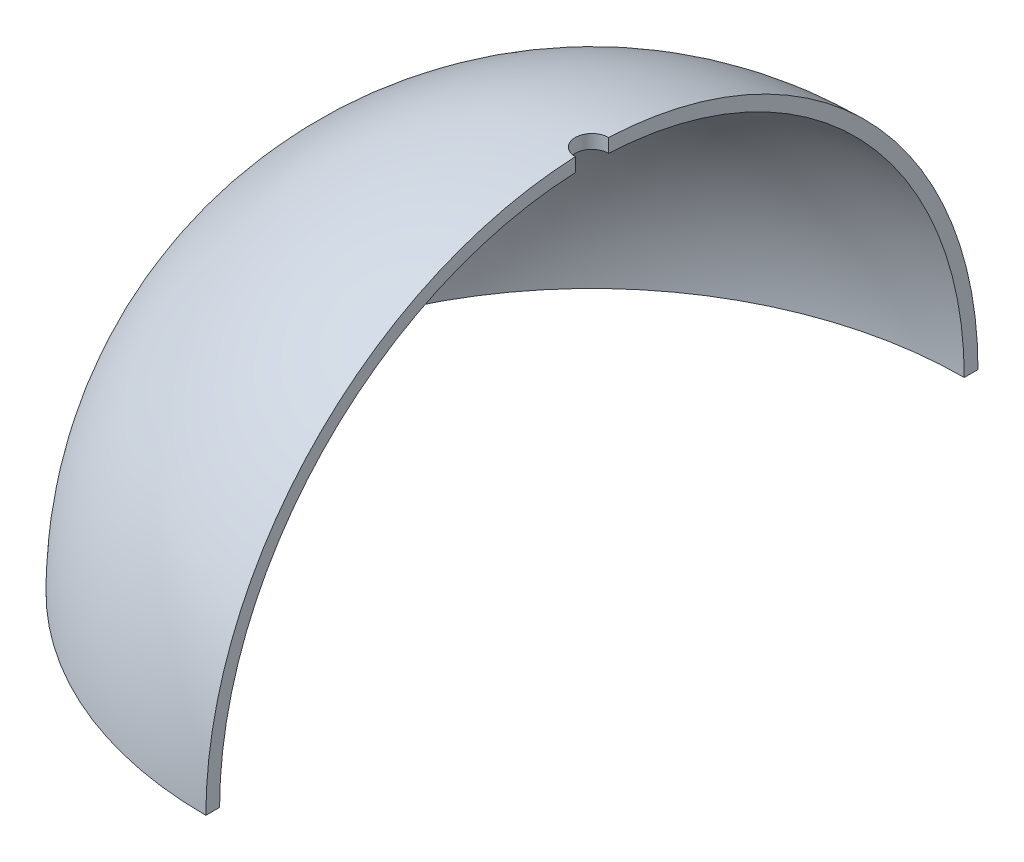
from build123d import *

# Parameters (mm, degrees)
REVOLVE1_ANGLE          = 90
CUT_EXTRUDE2_REACH      = 16066.771
CUT_EXTRUDE2_END_RADIUS = 9275
SKETCH5_R               = 400


with BuildPart() as part:
    # Sketch1 → Revolve1 (revolve)
    with BuildSketch(Plane(origin=(0, 0, 0), x_dir=(1, 0, 0), z_dir=(0, 1, 0))):
        with BuildLine():
            Line((0, 9275), (0, 8945))
            ThreePointArc((0, 8945), (-8945, 0), (0, -8945))
            Line((0, -8945), (0, -9275))
            ThreePointArc((0, -9275), (-9275, 0), (0, 9275))
        make_face()
    revolve(axis=Axis((0, 0, 41.715398803), (0, 0, -1)), revolution_arc=REVOLVE1_ANGLE)

    # Cut-Extrude2: up to this sphere (the profile starts inside it)
    cut_extrude2_end = Location((0, 0, 0)) * Sphere(CUT_EXTRUDE2_END_RADIUS, mode=Mode.PRIVATE)
    # Sketch5 → Cut-Extrude2 (cut, up to the surface)
    with BuildSketch(Plane(origin=(0, 0, 0), x_dir=(1, 0, 0), z_dir=(0, 1, 0)), mode=Mode.PRIVATE) as cut_extrude2_sk1:
        Circle(SKETCH5_R)
    cut_extrude2_tool1 = extrude(cut_extrude2_sk1.sketch, amount=CUT_EXTRUDE2_REACH, mode=Mode.PRIVATE) & cut_extrude2_end
    add(cut_extrude2_tool1.solids().sort_by_distance((0, 0, 0))[0], mode=Mode.SUBTRACT)


solid = part.part
